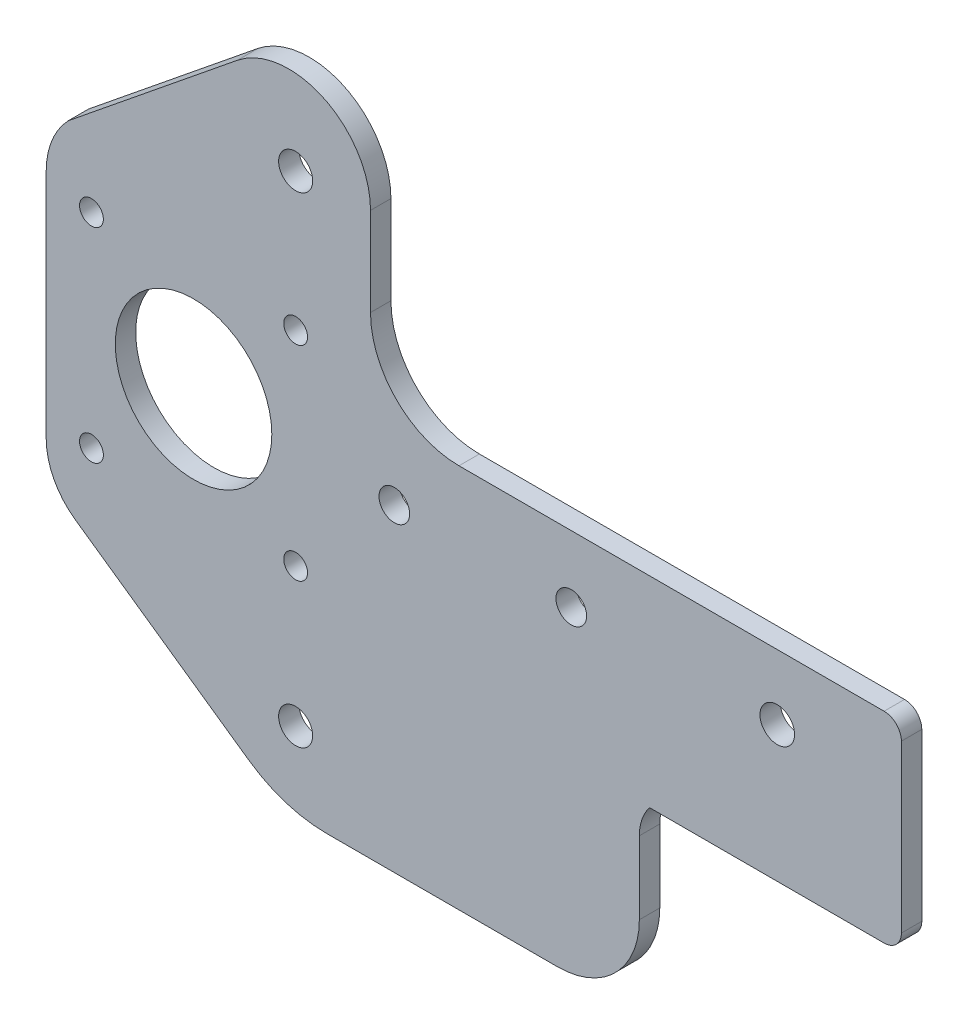
from build123d import *

# Parameters (mm, degrees)
SKETCH1_R           = 2.54
SKETCH1_R_2         = 2.25
SKETCH1_R_3         = 1.75
SKETCH1_R_4         = 2.5
SKETCH1_R_5         = 11.5
BOSS_EXTRUDE1_DEPTH = 3
FILLET2_R           = 2.54


with BuildPart() as part:
    # Sketch1 → Boss-Extrude1 (new body)
    with BuildSketch(Plane.XY):
        with BuildLine():
            Line((0, 0), (0, -29.5))
            Line((0, -29.5), (-37, -29.5))
            ThreePointArc((-37, -29.5), (-38.114378278, -31.538839171), (-38.5, -33.830127019))
            Line((-38.5, -33.830127019), (-38.5, -44.51209895))
            ThreePointArc((-38.5, -44.51209895), (-42.014718626, -52.997380324), (-50.5, -56.51209895))
            Line((-50.5, -56.51209895), (-84.414235636, -56.51209895))
            ThreePointArc((-84.414235636, -56.51209895), (-90.428351627, -55.586437965), (-95.885764364, -52.895139836))
            Line((-95.885764364, -52.895139836), (-121.385764364, -35.039847611))
            ThreePointArc((-121.385764364, -35.039847611), (-124.520108332, -31.465813301), (-125.65, -26.848327168))
            Line((-125.65, -26.848327168), (-125.65, 7.151672832))
            ThreePointArc((-125.65, 7.151672832), (-124.812422507, 11.481917426), (-122.420515459, 15.187499024))
            Line((-122.420515459, 15.187499024), (-97.551844693, 35.325751537))
            ThreePointArc((-97.551844693, 35.325751537), (-84.833866838, 36.831023412), (-78, 26))
            Line((-78, 26), (-78, 13))
            ThreePointArc((-78, 13), (-74.192388155, 3.807611845), (-65, 0))
            Line((-65, 0), (0, 0))
        make_face()
        with Locations((-18.237, -9.552)):
            Circle(SKETCH1_R, mode=Mode.SUBTRACT)
        with Locations((-48.5, -9.75)):
            Circle(SKETCH1_R_2, mode=Mode.SUBTRACT)
        with Locations((-74.5, -9.75)):
            Circle(SKETCH1_R_2, mode=Mode.SUBTRACT)
        with Locations((-89, 5.25)):
            Circle(SKETCH1_R_3, mode=Mode.SUBTRACT)
        with Locations((-89, 25.5)):
            Circle(SKETCH1_R_4, mode=Mode.SUBTRACT)
        with Locations((-89, -24.75)):
            Circle(SKETCH1_R_3, mode=Mode.SUBTRACT)
        with Locations((-89, -45.112)):
            Circle(SKETCH1_R_4, mode=Mode.SUBTRACT)
        with Locations((-104, -9.75)):
            Circle(SKETCH1_R_5, mode=Mode.SUBTRACT)
        with Locations((-119, 5.25)):
            Circle(SKETCH1_R_3, mode=Mode.SUBTRACT)
        with Locations((-119, -24.75)):
            Circle(SKETCH1_R_3, mode=Mode.SUBTRACT)
    extrude(amount=BOSS_EXTRUDE1_DEPTH)

    # Fillet2
    fillet2_edges = [part.edges().sort_by_distance(p)[0] for p in [
        (0, 0, 1.5),
        (0, -29.5, 1.5),
    ]]
    fillet(fillet2_edges, radius=FILLET2_R)


solid = part.part
